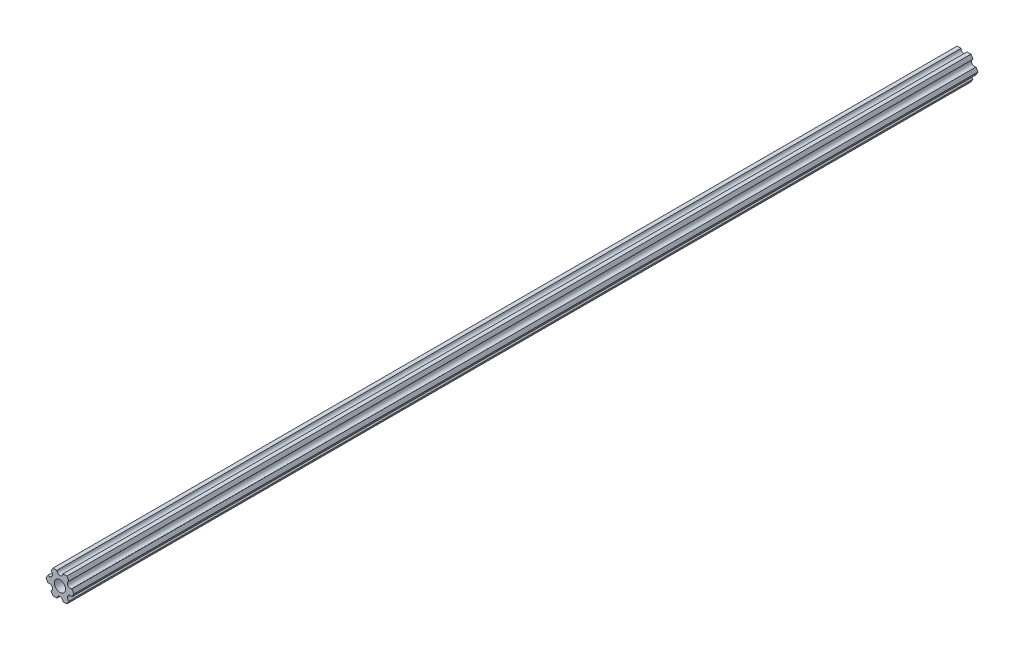
from build123d import *

# Parameters (mm, degrees)
SKETCH1_R           = 2.9337
BOSS_EXTRUDE1_DEPTH = 476.25


with BuildPart() as part:
    # Sketch1 → Boss-Extrude1 (new body)
    with BuildSketch(Plane.XY):
        with BuildLine():
            Line((-4.70551159, -4.549815043), (-3.666174521, -6.349999904))
            Line((-3.666174521, -6.349999904), (-1.587501154, -6.349999904))
            ThreePointArc((-1.587501154, -6.349999904), (-3.85e-07, -4.762499134), (1.587501154, -6.349999904))
            Line((1.587501154, -6.349999904), (3.666173825, -6.349999904))
            Line((3.666173825, -6.349999904), (4.705510929, -4.549815232))
            ThreePointArc((4.705510929, -4.549815232), (4.124445601, -2.381249904), (6.293010929, -1.800184575))
            Line((6.293010929, -1.800184575), (7.332348034, 9.6e-08))
            Line((7.332348034, 9.6e-08), (6.293011178, 1.800184715))
            ThreePointArc((6.293011178, 1.800184715), (4.124445902, 2.381250241), (4.705511428, 4.549815516))
            Line((4.705511428, 4.549815516), (3.666174521, 6.350000222))
            Line((3.666174521, 6.350000222), (1.587498846, 6.350000222))
            ThreePointArc((1.587498846, 6.350000222), (3.85e-07, 4.762501761), (-1.587498846, 6.350000222))
            Line((-1.587498846, 6.350000222), (-3.666173825, 6.350000222))
            Line((-3.666173825, 6.350000222), (-4.705511038, 4.549815614))
            ThreePointArc((-4.705511038, 4.549815614), (-4.124445841, 2.38125025), (-6.293011205, 1.800185053))
            Line((-6.293011205, 1.800185053), (-7.332348419, 4.44e-07))
            Line((-7.332348419, 4.44e-07), (-6.293011423, -1.80018429))
            ThreePointArc((-6.293011423, -1.80018429), (-4.12444613, -2.38124975), (-4.70551159, -4.549815043))
        make_face()
        Circle(SKETCH1_R, mode=Mode.SUBTRACT)
    extrude(amount=-BOSS_EXTRUDE1_DEPTH)


solid = part.part
